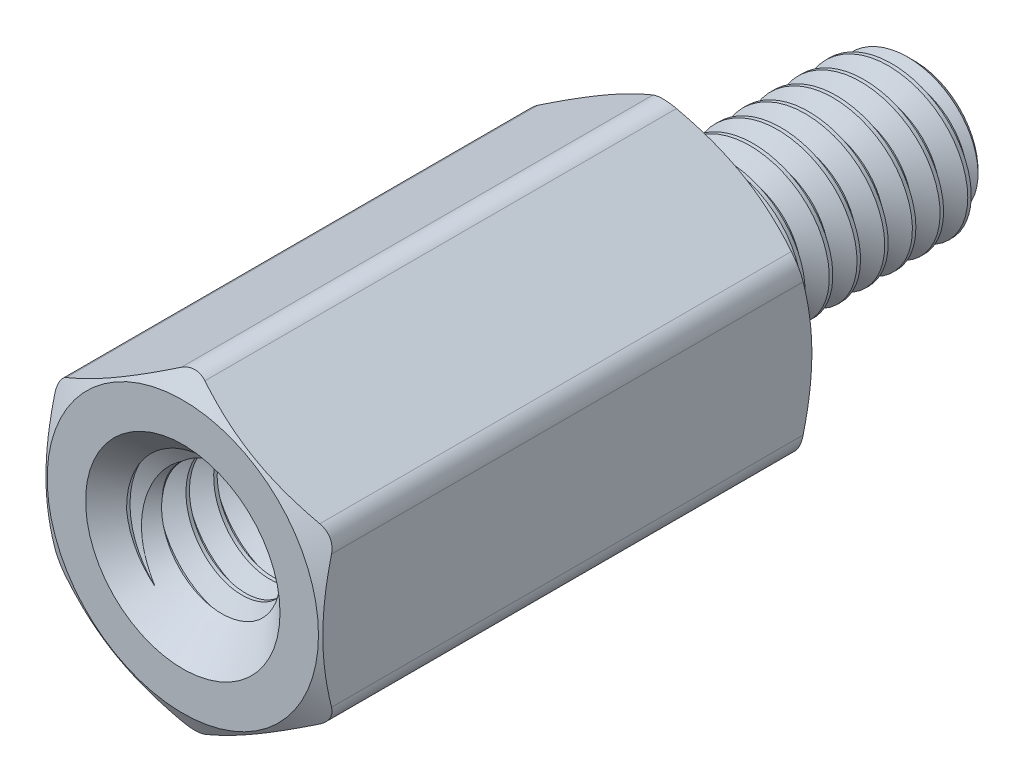
from build123d import *

# Parameters (mm, degrees)
SKETCH4_R           = 1.75
BOSS_EXTRUDE1_DEPTH = 8
SKETCH5_OUTSIDE_W   = 55.62
SKETCH5_OUTSIDE_H   = 56.316
SKETCH5_OUTSIDE_R   = 2.205
CUT_EXTRUDE1_DEPTH  = 13.386383653
CUT_EXTRUDE1_DRAFT  = -60
SKETCH6_OUTSIDE_W   = 42.874
SKETCH6_OUTSIDE_H   = 43.57
SKETCH6_OUTSIDE_R   = 2.205
CUT_EXTRUDE2_DEPTH  = 9.707037384
CUT_EXTRUDE2_DRAFT  = -60
FILLET1_R           = 0.3825
CUT_SWEEP1_PITCH    = 0.45
SKETCH9_R           = 1.475
BOSS_EXTRUDE2_DEPTH = 4.8
SKETCH10_W          = 4.8
SKETCH10_H          = 1.25
CUT_SWEEP2_PITCH    = 0.45


with BuildPart() as part:
    # Sketch3 → Revolve1 (revolve)
    with BuildSketch(Plane(origin=(0, 0, 0), x_dir=(0, 0, -1), z_dir=(1, 0, 0))):
        with BuildLine():
            Line((-3.2, 1.025), (-3.2, 0))
            Line((-3.2, 0), (3.9, 0))
            Line((3.9, 0), (3.9, 1.025))
            Line((3.9, 1.025), (3.675, 1.25))
            Line((3.675, 1.25), (0.63675, 1.25))
            Line((0.63675, 1.25), (0.468, 0.957716426))
            Line((0.468, 0.957716426), (0.225, 0.957716426))
            ThreePointArc((0.225, 0.957716426), (0.065900974, 1.0236174), (0, 1.182716426))
            Line((0, 1.182716426), (0, 2.25))
            Line((0, 2.25), (-8, 2.25))
            Line((-8, 2.25), (-8, 1.475))
            Line((-8, 1.475), (-7.775, 1.25))
            Line((-7.775, 1.25), (-3.425, 1.25))
            Line((-3.425, 1.25), (-3.2, 1.025))
        make_face()
    revolve(axis=Axis((0, 0, -3.9), (0, 0, 1)))

    # Sketch4 → Boss-Extrude1 (add)
    with BuildSketch(Plane.XY.offset(8)):
        Polygon((-2.25, 1.299038106), (-2.25, -1.299038106), (0, -2.598076211), (2.25, -1.299038106), (2.25, 1.299038106), (0, 2.598076211), align=None)
        Circle(SKETCH4_R, mode=Mode.SUBTRACT)
    extrude(amount=-BOSS_EXTRUDE1_DEPTH)


with BuildPart() as cut_extrude1_tool:
    # Sketch5 outside → Cut-Extrude1 (with draft: the straight prism first)
    with BuildSketch(Plane.XY.offset(8)):
        Rectangle(SKETCH5_OUTSIDE_W, SKETCH5_OUTSIDE_H)
        Circle(SKETCH5_OUTSIDE_R, mode=Mode.SUBTRACT)
    extrude(amount=-CUT_EXTRUDE1_DEPTH)
    # Cut-Extrude1: the draft: its side faces are tilted about the plane it starts from
    cut_extrude1_sides = [cut_extrude1_tool.faces().sort_by_distance(p)[0] for p in [
        (0, -28.158, 1.306808173),
        (27.81, 0, 1.306808173),
        (0, 28.158, 1.306808173),
        (-27.81, 0, 1.306808173),
        (-2.205, 0, 1.306808173),
    ]]
    draft(cut_extrude1_sides, Plane.XY.offset(8), CUT_EXTRUDE1_DRAFT)


with BuildPart() as part_1:
    add(part.part)

    # Cut-Extrude1: cut by cut_extrude1_tool
    add(cut_extrude1_tool.part, mode=Mode.SUBTRACT)


with BuildPart() as cut_extrude2_tool:
    # Sketch6 outside → Cut-Extrude2 (with draft: the straight prism first)
    with BuildSketch(Plane(origin=(0, 0, 0), x_dir=(-1, 0, 0), z_dir=(0, 0, -1))):
        Rectangle(SKETCH6_OUTSIDE_W, SKETCH6_OUTSIDE_H)
        Circle(SKETCH6_OUTSIDE_R, mode=Mode.SUBTRACT)
    extrude(amount=-CUT_EXTRUDE2_DEPTH)
    # Cut-Extrude2: the draft: its side faces are tilted about the plane it starts from
    cut_extrude2_sides = [cut_extrude2_tool.faces().sort_by_distance(p)[0] for p in [
        (0, -21.785, 4.853518692),
        (-21.437, 0, 4.853518692),
        (0, 21.785, 4.853518692),
        (21.437, 0, 4.853518692),
        (2.205, 0, 4.853518692),
    ]]
    draft(cut_extrude2_sides, Plane(origin=(0, 0, 0), x_dir=(-1, 0, 0), z_dir=(0, 0, -1)), CUT_EXTRUDE2_DRAFT)


with BuildPart() as part_2:
    add(part_1.part)

    # Cut-Extrude2: cut by cut_extrude2_tool
    add(cut_extrude2_tool.part, mode=Mode.SUBTRACT)

    # Fillet1
    fillet1_edges = [part_2.edges().sort_by_distance(p)[0] for p in [
        (0, 2.598076211, 4),
        (-2.25, -1.299038106, 4),
        (0, -2.598076211, 4),
        (2.25, -1.299038106, 4),
        (2.25, 1.299038106, 4),
        (-2.25, 1.299038106, 4),
    ]]
    fillet(fillet1_edges, radius=FILLET1_R)

    # Cut-Sweep1: the profile of Sketch7 profile screwed along a right-hand helix of 8.406667 turns, 6 arcs to a turn; built about Z, then put on its axis
    cut_sweep1_z = Axis((0, 0, 0), (0, 0, 1))
    cut_sweep1_corners = [(0.957416426, 0, -0.168923205), (0.957416426, 0, -0.224826795), (1.274356964, 0, -0.4078125), (1.274356964, 0, 0.0140625)]
    with BuildLine(mode=Mode.PRIVATE) as cut_sweep1_profile:
        Line(cut_sweep1_corners[0], cut_sweep1_corners[1])
        Line(cut_sweep1_corners[1], cut_sweep1_corners[2])
        Line(cut_sweep1_corners[2], cut_sweep1_corners[3])
        Line(cut_sweep1_corners[3], cut_sweep1_corners[0])
    cut_sweep1_cap = Face(cut_sweep1_profile.wire())
    cut_sweep1_turn_angles = [0, 30, 60, 90, 120, 150, 180, 210, 240, 270, 300, 330, 360]
    cut_sweep1_turn_weights = [1, 0.8660254037844387, 1, 0.8660254037844387, 1, 0.8660254037844387, 1, 0.8660254037844387, 1, 0.8660254037844387, 1, 0.8660254037844387, 1]
    cut_sweep1_turn_rails = [Edge.make_bspline([Vector(p[0], p[1], 0).rotate(cut_sweep1_z, cut_sweep1_turn_angles[k]) / cut_sweep1_turn_weights[k] + Vector(0, 0, p[2] + CUT_SWEEP1_PITCH * cut_sweep1_turn_angles[k] / 360) for k in range(13)], [0, 0, 0, 1, 1, 2, 2, 3, 3, 4, 4, 5, 5, 6, 6, 6], 2, cut_sweep1_turn_weights) for p in cut_sweep1_corners]
    cut_sweep1_turn_sides = [Face.make_surface_from_curves(cut_sweep1_turn_rails[p[0]], cut_sweep1_turn_rails[p[1]]) for p in [(0, 1), (1, 2), (2, 3), (3, 0)]]
    cut_sweep1_last_angles = [2880, 2910, 2940, 2970, 3000, 3013.2, 3026.4]
    cut_sweep1_last_weights = [1, 0.8660254037844387, 1, 0.8660254037844387, 1, 0.9735789028731546, 1]
    cut_sweep1_last_rails = [Edge.make_bspline([Vector(p[0], p[1], 0).rotate(cut_sweep1_z, cut_sweep1_last_angles[k]) / cut_sweep1_last_weights[k] + Vector(0, 0, p[2] + CUT_SWEEP1_PITCH * cut_sweep1_last_angles[k] / 360) for k in range(7)], [0, 0, 0, 1, 1, 2, 2, 3, 3, 3], 2, cut_sweep1_last_weights) for p in cut_sweep1_corners]
    cut_sweep1_last_sides = [Face.make_surface_from_curves(cut_sweep1_last_rails[p[0]], cut_sweep1_last_rails[p[1]]) for p in [(0, 1), (1, 2), (2, 3), (3, 0)]]
    cut_sweep1 = Plane(origin=(0, 0, -3.9), x_dir=(0, 1, 0), z_dir=(0, 0, 1)) * Solid(Shell([*[p.moved(Location((0, 0, CUT_SWEEP1_PITCH * i))) for i in range(8) for p in cut_sweep1_turn_sides], *cut_sweep1_last_sides, cut_sweep1_cap, cut_sweep1_cap.rotate(cut_sweep1_z, 3026.4).moved(Location((0, 0, CUT_SWEEP1_PITCH * 3026.4 / 360)))]))
    add(cut_sweep1, mode=Mode.SUBTRACT)

    # Sketch9 → Boss-Extrude2 (add)
    with BuildSketch(Plane.XY.offset(3.2)):
        Circle(SKETCH9_R)
    extrude(amount=BOSS_EXTRUDE2_DEPTH)


with BuildPart() as body_2:
    # Sketch10 → Revolve2 (revolve)
    with BuildSketch(Plane(origin=(0, 0, 0), x_dir=(0, 0, -1), z_dir=(1, 0, 0))):
        with Locations((-5.6, 0.625)):
            Rectangle(SKETCH10_W, SKETCH10_H)
    revolve(axis=Axis((0, 0, -3.9), (0, 0, 1)))

    # Cut-Sweep2: the profile of Sketch12 profile screwed along a right-hand helix of 11.666667 turns, 6 arcs to a turn; built about Z, then put on its axis
    cut_sweep2_z = Axis((0, 0, 0), (0, 0, 1))
    cut_sweep2_corners = [(0.957416426, 0, -0.224826795), (0.957416426, 0, -0.168923205), (1.274356964, 0, 0.0140625), (1.274356964, 0, -0.4078125)]
    with BuildLine(mode=Mode.PRIVATE) as cut_sweep2_profile:
        Line(cut_sweep2_corners[0], cut_sweep2_corners[1])
        Line(cut_sweep2_corners[1], cut_sweep2_corners[2])
        Line(cut_sweep2_corners[2], cut_sweep2_corners[3])
        Line(cut_sweep2_corners[3], cut_sweep2_corners[0])
    cut_sweep2_cap = Face(cut_sweep2_profile.wire())
    cut_sweep2_turn_angles = [0, 30, 60, 90, 120, 150, 180, 210, 240, 270, 300, 330, 360]
    cut_sweep2_turn_weights = [1, 0.8660254037844387, 1, 0.8660254037844387, 1, 0.8660254037844387, 1, 0.8660254037844387, 1, 0.8660254037844387, 1, 0.8660254037844387, 1]
    cut_sweep2_turn_rails = [Edge.make_bspline([Vector(p[0], p[1], 0).rotate(cut_sweep2_z, cut_sweep2_turn_angles[k]) / cut_sweep2_turn_weights[k] + Vector(0, 0, p[2] + CUT_SWEEP2_PITCH * cut_sweep2_turn_angles[k] / 360) for k in range(13)], [0, 0, 0, 1, 1, 2, 2, 3, 3, 4, 4, 5, 5, 6, 6, 6], 2, cut_sweep2_turn_weights) for p in cut_sweep2_corners]
    cut_sweep2_turn_sides = [Face.make_surface_from_curves(cut_sweep2_turn_rails[p[0]], cut_sweep2_turn_rails[p[1]]) for p in [(0, 1), (1, 2), (2, 3), (3, 0)]]
    cut_sweep2_last_angles = [3960, 3990, 4020, 4050, 4080, 4110, 4140, 4170, 4200]
    cut_sweep2_last_weights = [1, 0.8660254037844387, 1, 0.8660254037844387, 1, 0.8660254037844387, 1, 0.8660254037842522, 1]
    cut_sweep2_last_rails = [Edge.make_bspline([Vector(p[0], p[1], 0).rotate(cut_sweep2_z, cut_sweep2_last_angles[k]) / cut_sweep2_last_weights[k] + Vector(0, 0, p[2] + CUT_SWEEP2_PITCH * cut_sweep2_last_angles[k] / 360) for k in range(9)], [0, 0, 0, 1, 1, 2, 2, 3, 3, 4, 4, 4], 2, cut_sweep2_last_weights) for p in cut_sweep2_corners]
    cut_sweep2_last_sides = [Face.make_surface_from_curves(cut_sweep2_last_rails[p[0]], cut_sweep2_last_rails[p[1]]) for p in [(0, 1), (1, 2), (2, 3), (3, 0)]]
    cut_sweep2 = Plane(origin=(0, 0, 8), x_dir=(0, 1, 0), z_dir=(0, 0, -1)) * Solid(Shell([*[p.moved(Location((0, 0, CUT_SWEEP2_PITCH * i))) for i in range(11) for p in cut_sweep2_turn_sides], *cut_sweep2_last_sides, cut_sweep2_cap, cut_sweep2_cap.rotate(cut_sweep2_z, 4200).moved(Location((0, 0, CUT_SWEEP2_PITCH * 4200 / 360)))]))
    add(cut_sweep2, mode=Mode.SUBTRACT)


with BuildPart() as part_3:
    add(part_2.part)

    # Combine1: cut body 2
    add(body_2.part, mode=Mode.SUBTRACT)

    # Cut-Extrude3 cone 1 section (through the dimple's axis) → Cut-Extrude3 (revolve, cut)
    with BuildSketch(Plane(origin=(0, 0, 8), x_dir=(0, -1, 0), z_dir=(1, 0, 0))):
        Polygon((0, 0), (1.58, 0), (0, 1.58), align=None)
    revolve(axis=Axis((0, 0, 8), (0, 0, -1)), mode=Mode.SUBTRACT)


solid = part_3.part
